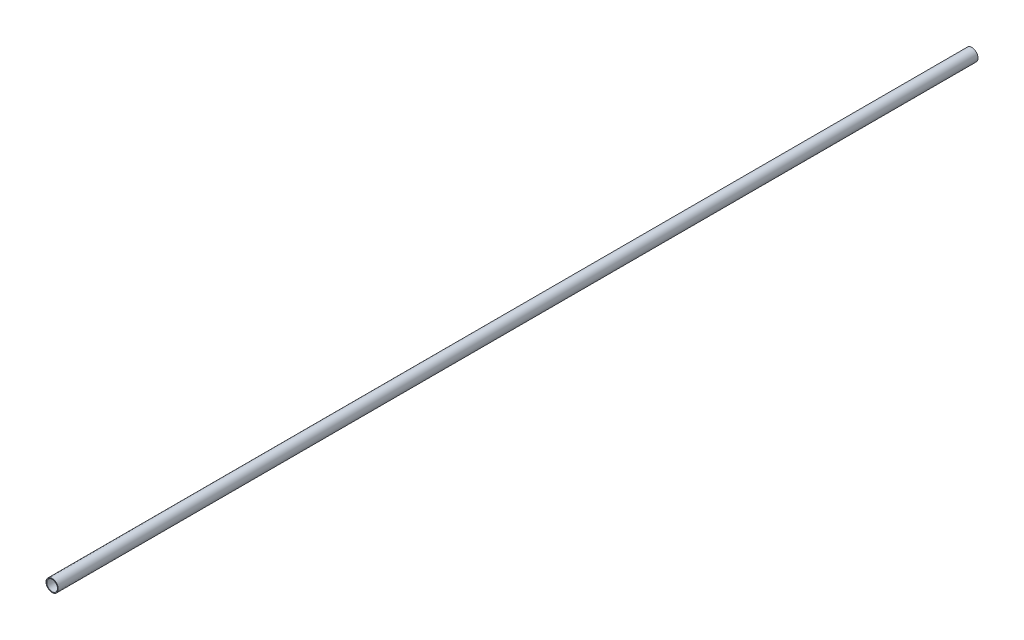
from build123d import *

# Parameters (mm, degrees)
SKETCH1_R           = 4
SKETCH1_R_2         = 3.5
BOSS_EXTRUDE1_DEPTH = 300


with BuildPart() as part:
    # Sketch1 → Boss-Extrude1 (new, symmetric)
    with BuildSketch(Plane.XY):
        Circle(SKETCH1_R)
        Circle(SKETCH1_R_2, mode=Mode.SUBTRACT)
    extrude(amount=BOSS_EXTRUDE1_DEPTH, both=True)


solid = part.part
